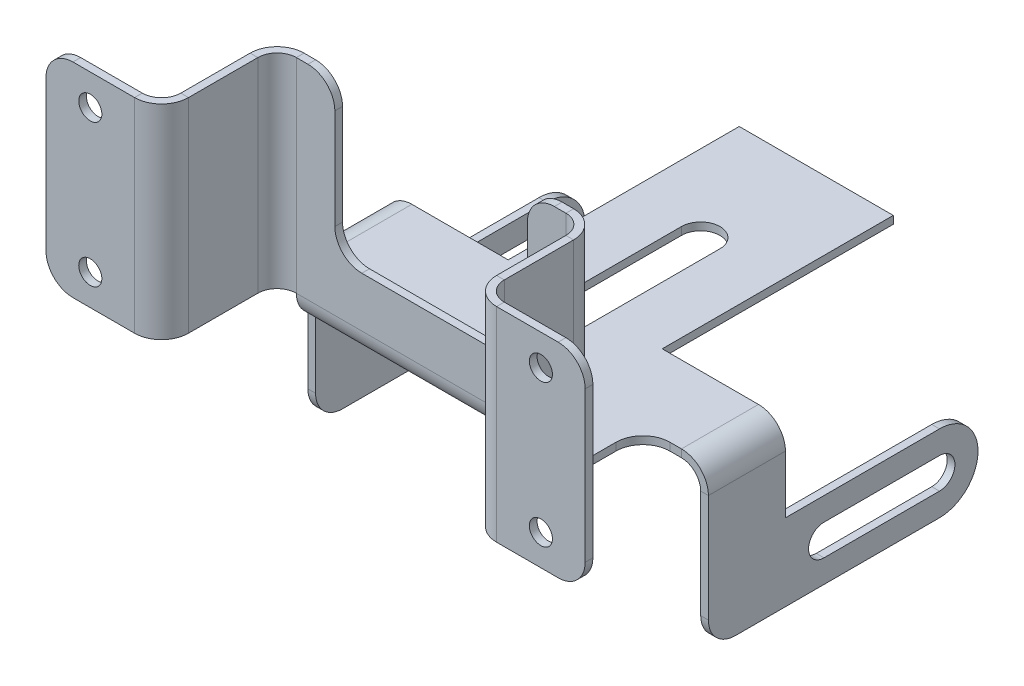
from build123d import *

# Parameters (mm, degrees)
SKETCH_1_W                       = 50
SKETCH_1_H                       = 1
SM_BASE_FLANGE_1_DEPTH           = 5
SM_EDGE_FLANGE_1_STRIP_W         = 9
SM_EDGE_FLANGE_1_STRIP_H         = 1
SM_EDGE_FLANGE_1_STRIP_CUT_DEPTH = 10
SM_EDGE_FLANGE_1_DEPTH           = 10
SM_BASE_FLANGE_1_2_DEPTH         = 1
SKETCH_12_W                      = 20
SKETCH_12_H                      = 30
SKETCH_12_W_2                    = 35
SKETCH_12_H_2                    = 10
SM_BASE_FLANGE_2_DEPTH           = 1
SM_EDGE_FLANGE_3_STRIP_W         = 9
SM_EDGE_FLANGE_3_STRIP_H         = 1
SM_EDGE_FLANGE_3_STRIP_CUT_DEPTH = 35
SM_EDGE_FLANGE_3_DEPTH           = 35
CUT_EXTRUDE_1_REACH              = 65.38
SKETCH_21_W                      = 25
SKETCH_21_H                      = 20
SM_EDGE_FLANGE_4_DEPTH           = 26.5
SM_EDGE_FLANGE_5_STRIP_W         = 9
SM_EDGE_FLANGE_5_STRIP_H         = 1
SM_EDGE_FLANGE_5_STRIP_CUT_DEPTH = 26.5
SM_EDGE_FLANGE_5_DEPTH           = 26.5
CUT_EXTRUDE_2_REACH              = 81.316
SKETCH_28_R                      = 1.5
FILLET_1_R                       = 3.5
CUT_EXTRUDE_3_REACH              = 59.879


# Sheet-metal steps are written as plain solids
with BuildPart() as part:
    # Sketch 1 → Sm Base Flange 1 (new, symmetric)
    with BuildSketch(Plane.XY):
        with Locations((0, -0.5)):
            Rectangle(SKETCH_1_W, SKETCH_1_H)
    extrude(amount=SM_BASE_FLANGE_1_DEPTH, both=True)

    # 边线-法兰1 strip (across the edge) → 边线-法兰1 strip cut (cut)
    with BuildSketch(Plane(origin=(-25, -1, 5), x_dir=(1, 0, 0), z_dir=(0, 0, -1))):
        with Locations((-2, -0.5)):
            Rectangle(SM_EDGE_FLANGE_1_STRIP_W, SM_EDGE_FLANGE_1_STRIP_H)
    sm_edge_flange_1_strip_cut = extrude(amount=SM_EDGE_FLANGE_1_STRIP_CUT_DEPTH, mode=Mode.SUBTRACT)

    # 边线-法兰1 section (across the edge) → 边线-法兰1 (add)
    with BuildSketch(Plane(origin=(-25, -1, 5), x_dir=(1, 0, 0), z_dir=(0, 0, -1))):
        with BuildLine():
            Line((-1, 2.5), (-1, 20))
            Line((-1, 20), (0, 20))
            Line((0, 20), (0, 2.5))
            ThreePointArc((0, 2.5), (0.732233047, 0.732233047), (2.5, 0))
            Line((2.5, 0), (2.5, -1))
            ThreePointArc((2.5, -1), (0.025126266, 0.025126266), (-1, 2.5))
        make_face()
    sm_edge_flange_1 = extrude(amount=SM_EDGE_FLANGE_1_DEPTH)

    # 草图9 → Sm Base Flange 1 2 (add)
    with BuildSketch(Plane.ZY.offset(26)):
        with BuildLine():
            Line((-5, -21), (-25, -21))
            ThreePointArc((-25, -21), (-30, -16), (-25, -11))
            Line((-25, -11), (-5, -11))
            Line((-5, -11), (-5, -21))
        make_face()
        with BuildLine():
            Line((-10, -18), (-25, -18))
            ThreePointArc((-25, -18), (-27, -16), (-25, -14))
            Line((-25, -14), (-10, -14))
            ThreePointArc((-10, -14), (-8, -16), (-10, -18))
        make_face(mode=Mode.SUBTRACT)
    sm_base_flange_1_2 = extrude(amount=-SM_BASE_FLANGE_1_2_DEPTH)

    # 镜向1: 边线-法兰1 strip cut, 边线-法兰1, Sm Base Flange 1 2 across plane
    add(sm_edge_flange_1_strip_cut.mirror(Plane(origin=(0, 0, 0), x_dir=(0, 0, 1), z_dir=(1, 0, 0))), mode=Mode.SUBTRACT)
    add(sm_edge_flange_1.mirror(Plane(origin=(0, 0, 0), x_dir=(0, 0, 1), z_dir=(1, 0, 0))))
    add(sm_base_flange_1_2.mirror(Plane(origin=(0, 0, 0), x_dir=(0, 0, 1), z_dir=(1, 0, 0))))

    # 草图12 → 薄片2 (add)
    with BuildSketch(Plane.XZ.offset(1)):
        with Locations((0, -20)):
            Rectangle(SKETCH_12_W, SKETCH_12_H)
        with Locations((0, 10)):
            Rectangle(SKETCH_12_W_2, SKETCH_12_H_2)
    extrude(amount=-SM_BASE_FLANGE_2_DEPTH)

    # 边线-法兰3 strip (across the edge) → 边线-法兰3 strip cut (cut)
    with BuildSketch(Plane(origin=(-17.5, 0, 15), x_dir=(0, 0, -1), z_dir=(1, 0, 0))):
        with Locations((-1, -0.5)):
            Rectangle(SM_EDGE_FLANGE_3_STRIP_W, SM_EDGE_FLANGE_3_STRIP_H)
    extrude(amount=SM_EDGE_FLANGE_3_STRIP_CUT_DEPTH, mode=Mode.SUBTRACT)

    # 边线-法兰3 section (across the edge) → 边线-法兰3 (add)
    with BuildSketch(Plane(origin=(-17.5, 0, 15), x_dir=(0, 0, -1), z_dir=(1, 0, 0))):
        with BuildLine():
            Line((0, 2.5), (0, 29))
            Line((0, 29), (1, 29))
            Line((1, 29), (1, 2.5))
            ThreePointArc((1, 2.5), (1.732233047, 0.732233047), (3.5, 0))
            Line((3.5, 0), (3.5, -1))
            ThreePointArc((3.5, -1), (1.025126266, 0.025126266), (0, 2.5))
        make_face()
    extrude(amount=SM_EDGE_FLANGE_3_DEPTH)

    # 草图21 → 切除-拉伸1 (cut, up to next)
    with BuildSketch(Plane.XY.offset(15), mode=Mode.PRIVATE) as cut_extrude_1_sk1:
        with Locations((0, 19)):
            Rectangle(SKETCH_21_W, SKETCH_21_H)
    cut_extrude_1_tool1 = extrude(cut_extrude_1_sk1.sketch, amount=-CUT_EXTRUDE_1_REACH, mode=Mode.PRIVATE) & part.part
    add(cut_extrude_1_tool1.solids().sort_by_distance((0, 19, 15))[0], mode=Mode.SUBTRACT)

    # 边线-法兰4 section (across the edge) → 边线-法兰4 (add)
    with BuildSketch(Plane(origin=(-20, 29, 15), x_dir=(1, 0, 0), z_dir=(0, -1, 0))):
        with BuildLine():
            Line((-1, 2.5), (-1, 14))
            Line((-1, 14), (0, 14))
            Line((0, 14), (0, 2.5))
            ThreePointArc((0, 2.5), (0.732233047, 0.732233047), (2.5, 0))
            Line((2.5, 0), (2.5, -1))
            ThreePointArc((2.5, -1), (0.025126266, 0.025126266), (-1, 2.5))
        make_face()
    sm_edge_flange_4 = extrude(amount=SM_EDGE_FLANGE_4_DEPTH)

    # 边线-法兰5 strip (across the edge) → 边线-法兰5 strip cut (cut)
    with BuildSketch(Plane(origin=(-21, 2.5, 29), x_dir=(0, 0, -1), z_dir=(0, 1, 0))):
        with Locations((-2, -0.5)):
            Rectangle(SM_EDGE_FLANGE_5_STRIP_W, SM_EDGE_FLANGE_5_STRIP_H)
    sm_edge_flange_5_strip_cut = extrude(amount=SM_EDGE_FLANGE_5_STRIP_CUT_DEPTH, mode=Mode.SUBTRACT)

    # 边线-法兰5 section (across the edge) → 边线-法兰5 (add)
    with BuildSketch(Plane(origin=(-21, 2.5, 29), x_dir=(0, 0, -1), z_dir=(0, 1, 0))):
        with BuildLine():
            Line((-1, 2.5), (-1, 14))
            Line((-1, 14), (0, 14))
            Line((0, 14), (0, 2.5))
            ThreePointArc((0, 2.5), (0.732233047, 0.732233047), (2.5, 0))
            Line((2.5, 0), (2.5, -1))
            ThreePointArc((2.5, -1), (0.025126266, 0.025126266), (-1, 2.5))
        make_face()
    sm_edge_flange_5 = extrude(amount=SM_EDGE_FLANGE_5_DEPTH)

    # 草图28 → 切除-拉伸2 (cut, up to next)
    with BuildSketch(Plane.XY.offset(30), mode=Mode.PRIVATE) as cut_extrude_2_sk1:
        with Locations((-29.25, 25)):
            Circle(SKETCH_28_R)
    cut_extrude_2_tool1 = extrude(cut_extrude_2_sk1.sketch, amount=-CUT_EXTRUDE_2_REACH, mode=Mode.PRIVATE) & part.part
    # 草图28 → 切除-拉伸2 (cut, up to next)
    with BuildSketch(Plane.XY.offset(30), mode=Mode.PRIVATE) as cut_extrude_2_sk2:
        with Locations(Location((-29.25, 6.5, 0), (0, 0, 180))):
            Circle(SKETCH_28_R)
    cut_extrude_2_tool2 = extrude(cut_extrude_2_sk2.sketch, amount=-CUT_EXTRUDE_2_REACH, mode=Mode.PRIVATE) & part.part
    cut_extrude_2_1 = cut_extrude_2_tool1.solids().sort_by_distance((-29.25, 25, 30))[0]
    add(cut_extrude_2_1, mode=Mode.SUBTRACT)
    cut_extrude_2_2 = cut_extrude_2_tool2.solids().sort_by_distance((-29.25, 6.5, 30))[0]
    add(cut_extrude_2_2, mode=Mode.SUBTRACT)
    cut_extrude_2 = cut_extrude_2_1 + cut_extrude_2_2  # 切除-拉伸2 as one shape, for the pattern or mirror that repeats it

    # 镜向2: 边线-法兰4, 边线-法兰5 strip cut, 边线-法兰5, 切除-拉伸2 across plane
    add(sm_edge_flange_4.mirror(Plane(origin=(0, 0, 0), x_dir=(0, 0, 1), z_dir=(1, 0, 0))))
    add(sm_edge_flange_5_strip_cut.mirror(Plane(origin=(0, 0, 0), x_dir=(0, 0, 1), z_dir=(1, 0, 0))), mode=Mode.SUBTRACT)
    add(sm_edge_flange_5.mirror(Plane(origin=(0, 0, 0), x_dir=(0, 0, 1), z_dir=(1, 0, 0))))
    add(cut_extrude_2.mirror(Plane(origin=(0, 0, 0), x_dir=(0, 0, 1), z_dir=(1, 0, 0))), mode=Mode.SUBTRACT)

    # 圆角1
    fillet_1_edges = [part.edges().sort_by_distance(p)[0] for p in [
        (17.5, -0.5, 5),
        (-17.5, -0.5, 5),
        (12.5, 29, 14.5),
        (12.5, 9, 14.5),
        (-12.5, 9, 14.5),
        (-12.5, 29, 14.5),
        (-35, 2.5, 29.5),
        (-35, 29, 29.5),
        (35, 29, 29.5),
        (35, 2.5, 29.5),
        (-25.5, -21, 5),
        (25.5, -21, 5),
    ]]
    fillet(fillet_1_edges, radius=FILLET_1_R)

    # 草图29 → 切除-拉伸3 (cut, up to next)
    with BuildSketch(Plane.XZ.offset(1), mode=Mode.PRIVATE) as cut_extrude_3_sk1:
        with BuildLine():
            Line((2.5, 0), (2.5, -20))
            ThreePointArc((2.5, -20), (0, -22.5), (-2.5, -20))
            Line((-2.5, -20), (-2.5, 0))
            ThreePointArc((-2.5, 0), (0, 2.5), (2.5, 0))
        make_face()
    cut_extrude_3_tool1 = extrude(cut_extrude_3_sk1.sketch, amount=-CUT_EXTRUDE_3_REACH, mode=Mode.PRIVATE) & part.part
    add(cut_extrude_3_tool1.solids().sort_by_distance((0, -1, -10))[0], mode=Mode.SUBTRACT)


solid = part.part
